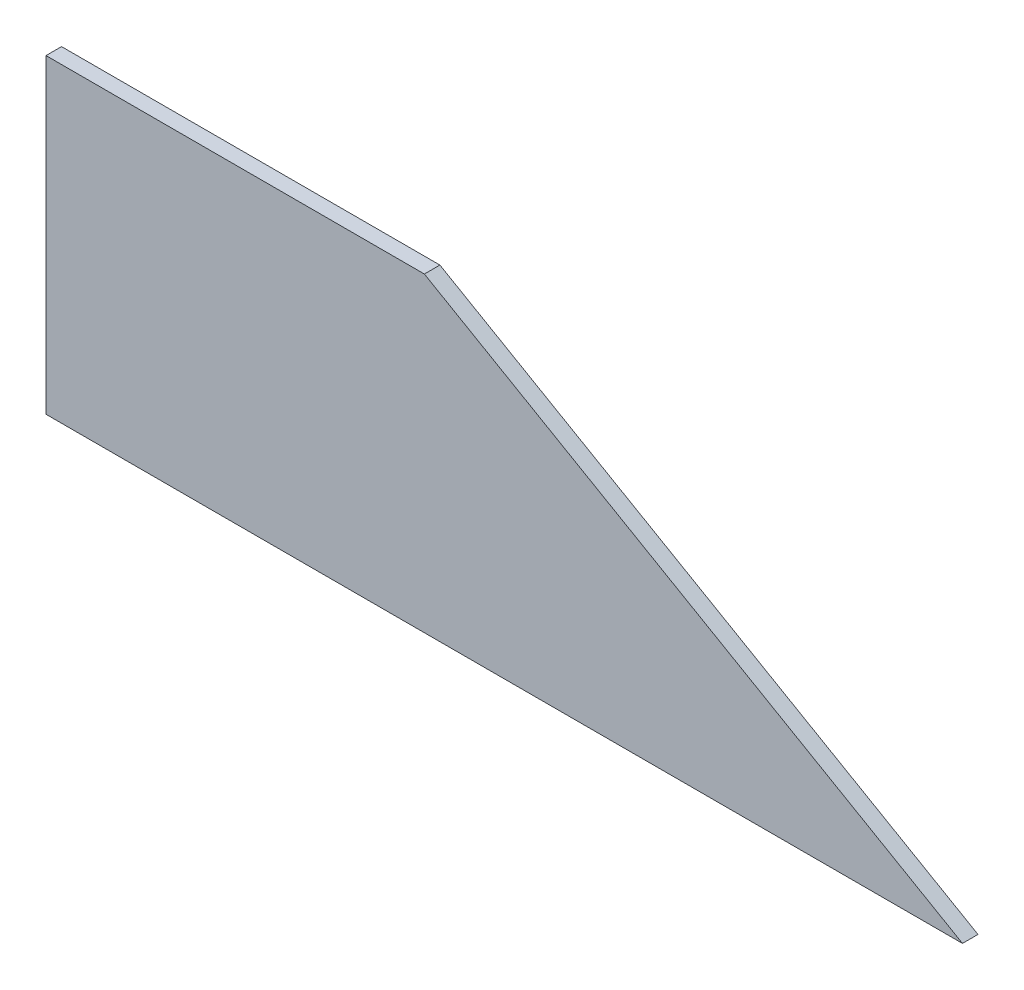
from build123d import *

# Parameters (mm, degrees)
BOSS_EXTRUDE1_DEPTH = 3.175


with BuildPart() as part:
    # Sketch1 → Boss-Extrude1 (new body)
    with BuildSketch(Plane.XY):
        Polygon((77.339773719, 63.5), (187.325, 0), (77.339773719, 0), (0, 0), (0, 63.5), align=None)
    extrude(amount=BOSS_EXTRUDE1_DEPTH)


solid = part.part
